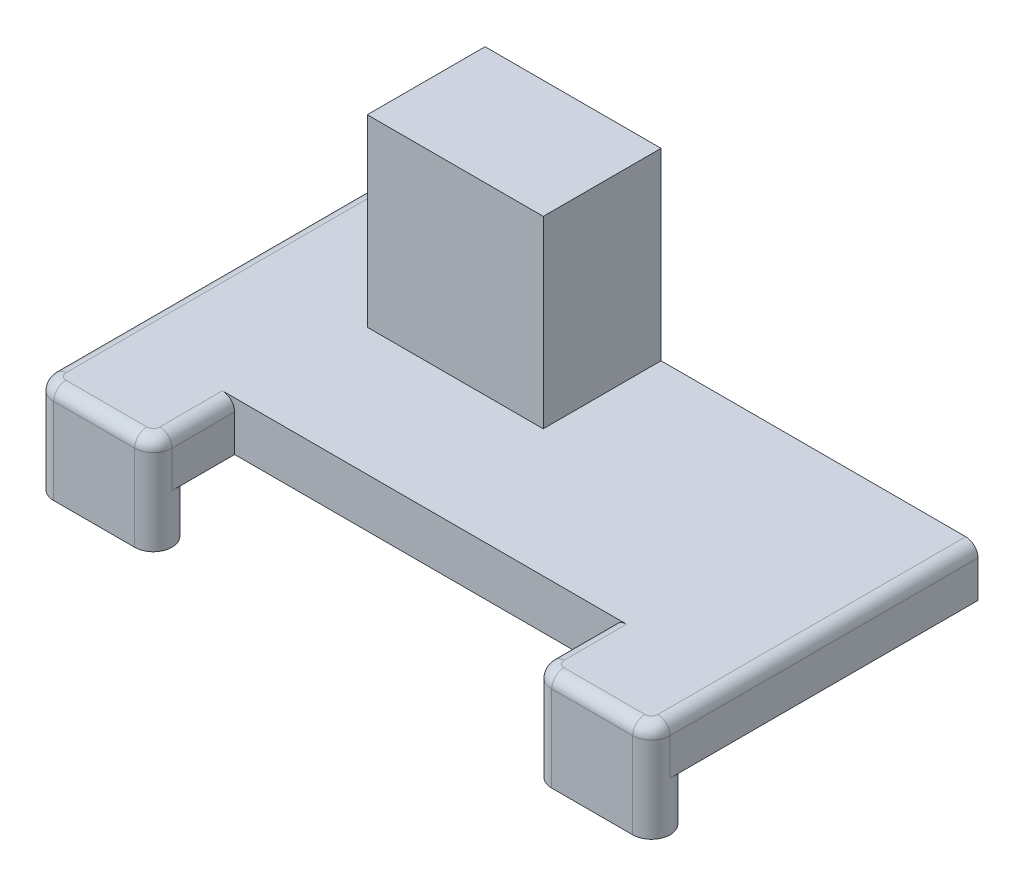
from build123d import *

# Parameters (mm, degrees)
BOSS_EXTRUDE1_DEPTH   = 4
BOSS_EXTRUDE1_2_DEPTH = 4
BOSS_EXTRUDE3_DEPTH   = 4
FILLET2_R             = 1
SKETCH4_W             = 14.347682942
SKETCH4_H             = 9.604544397
BOSS_EXTRUDE4_DEPTH   = 15


with BuildPart() as part:
    # Sketch1 → Boss-Extrude1 (new body)
    with BuildSketch(Plane(origin=(0, 0, 0), x_dir=(1, 0, 0), z_dir=(0, 1, 0))):
        with BuildLine():
            Line((-23.6, 10.542278437), (-17, 10.542278437))
            ThreePointArc((-17, 10.542278437), (-15.475, 9.017278437), (-17, 7.492278437))
            Line((-17, 7.492278437), (-23.6, 7.492278437))
            ThreePointArc((-23.6, 7.492278437), (-25.125, 9.017278437), (-23.6, 10.542278437))
        make_face()
    extrude(amount=BOSS_EXTRUDE1_DEPTH)



with BuildPart() as body_2:
    # Sketch1 → Boss-Extrude1 2 (new body)
    with BuildSketch(Plane(origin=(0, 0, 0), x_dir=(1, 0, 0), z_dir=(0, 1, 0))):
        with BuildLine():
            Line((23.6, 7.492278437), (17, 7.492278437))
            ThreePointArc((17, 7.492278437), (15.475, 9.017278437), (17, 10.542278437))
            Line((17, 10.542278437), (23.6, 10.542278437))
            ThreePointArc((23.6, 10.542278437), (25.125, 9.017278437), (23.6, 7.492278437))
        make_face()
    extrude(amount=BOSS_EXTRUDE1_2_DEPTH)


with BuildPart() as part_1:
    add(part.part)

    add(body_2.part)  # Boss-Extrude3 merges body 2
    # Sketch3 → Boss-Extrude3 (add)
    with BuildSketch(Plane(origin=(0, 4, 0), x_dir=(1, 0, 0), z_dir=(0, 1, 0))):
        with BuildLine():
            ThreePointArc((15.475, 9.017278437), (15.921662159, 7.938940596), (17, 7.492278437))
            Line((17, 7.492278437), (23.6, 7.492278437))
            ThreePointArc((23.6, 7.492278437), (24.678337841, 7.938940596), (25.125, 9.017278437))
            Line((25.125, 9.017278437), (25.125, 34.117278437))
            Line((25.125, 34.117278437), (-25.125, 34.117278437))
            Line((-25.125, 34.117278437), (-25.125, 9.017278437))
            ThreePointArc((-25.125, 9.017278437), (-24.678337841, 7.938940596), (-23.6, 7.492278437))
            Line((-23.6, 7.492278437), (-17, 7.492278437))
            ThreePointArc((-17, 7.492278437), (-15.921662159, 7.938940596), (-15.475, 9.017278437))
            Line((-15.475, 9.017278437), (-15.475, 14.117278437))
            Line((-15.475, 14.117278437), (15.475, 14.117278437))
            Line((15.475, 14.117278437), (15.475, 9.017278437))
        make_face()
    extrude(amount=BOSS_EXTRUDE3_DEPTH)

    # Fillet2
    fillet2_edges = [part_1.edges().sort_by_distance(p)[0] for p in [
        (-25.125, 8, -21.567278437),
        (-24.678337841, 8, -7.938940596),
        (-15.475, 8, -11.567278437),
        (-15.921662159, 8, -7.938940596),
        (15.475, 8, -11.567278437),
        (15.921662159, 8, -7.938940596),
        (25.125, 8, -21.567278437),
        (24.678337841, 8, -7.938940596),
        (-20.3, 8, -7.492278437),
        (20.3, 8, -7.492278437),
    ]]
    fillet(fillet2_edges, radius=FILLET2_R)

    # Sketch4 → Boss-Extrude4 (add)
    with BuildSketch(Plane(origin=(0, 8, 0), x_dir=(1, 0, 0), z_dir=(0, 1, 0))):
        with Locations((-7.885296824, 29.315006239)):
            Rectangle(SKETCH4_W, SKETCH4_H)
    extrude(amount=BOSS_EXTRUDE4_DEPTH)


solid = part_1.part
